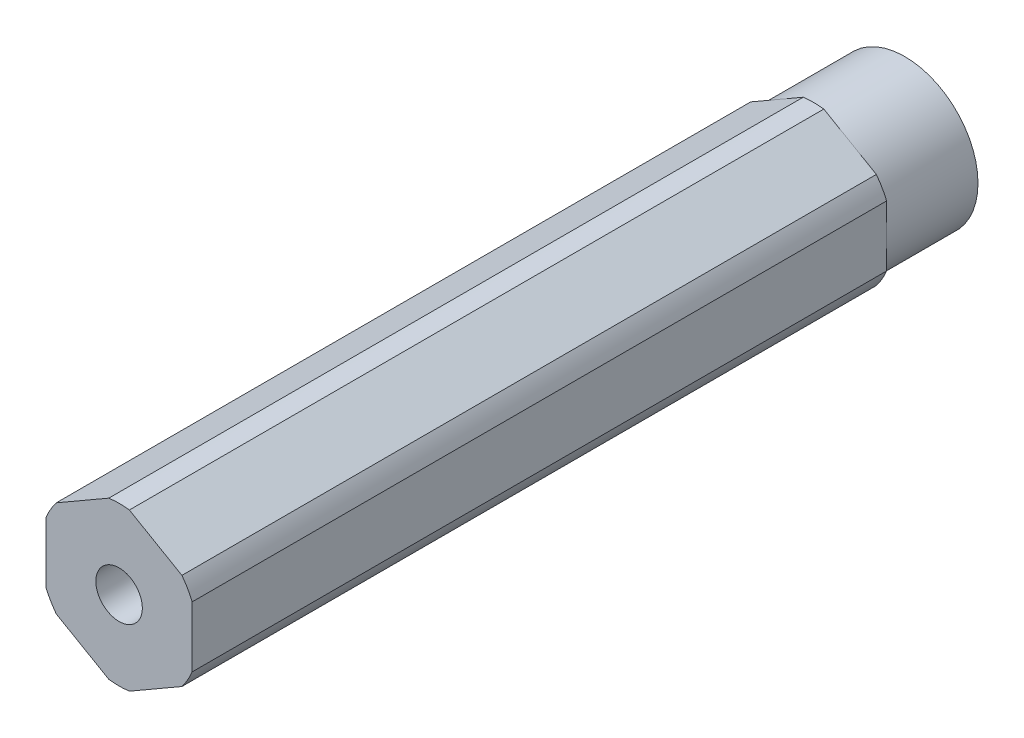
from build123d import *

# Parameters (mm, degrees)
BOSS_EXTRUDE1_DEPTH                  = 34.13125
SKETCH3_R                            = 2.0193
CUT_EXTRUDE1_DEPTH                   = 69.901066982
CUT_EXTRUDE3_START                   = -7.9375
SKETCH8_R                            = 6.875
SKETCH8_R_2                          = 6.35
CUT_EXTRUDE3_DEPTH                   = 7.9375
F_10_32_TAPPED_HOLE1_D               = 4.0386
F_10_32_TAPPED_HOLE1_DEPTH           = 12.02944
F_10_32_TAPPED_HOLE1_TIP             = 1.213317848
F_10_32_TAPPED_HOLE1_ON_FACE_2_D     = 4.0386
F_10_32_TAPPED_HOLE1_ON_FACE_2_DEPTH = 12.02944
F_10_32_TAPPED_HOLE1_ON_FACE_2_TIP   = 1.213317848


with BuildPart() as part:
    # Sketch1 → Boss-Extrude1 (new, symmetric)
    with BuildSketch(Plane.XY):
        with BuildLine():
            Line((-0.893039494, 6.816751826), (-5.456960506, 4.181770802))
            ThreePointArc((-5.456960506, 4.181770802), (-5.953924651, 3.4375), (-6.35, 2.634981025))
            Line((-6.35, 2.634981025), (-6.35, -2.634981025))
            ThreePointArc((-6.35, -2.634981025), (-5.953924651, -3.4375), (-5.456960506, -4.181770802))
            Line((-5.456960506, -4.181770802), (-0.893039494, -6.816751826))
            ThreePointArc((-0.893039494, -6.816751826), (0, -6.875), (0.893039494, -6.816751826))
            Line((0.893039494, -6.816751826), (5.456960506, -4.181770802))
            ThreePointArc((5.456960506, -4.181770802), (5.953924651, -3.4375), (6.35, -2.634981025))
            Line((6.35, -2.634981025), (6.35, 2.634981025))
            ThreePointArc((6.35, 2.634981025), (5.953924651, 3.4375), (5.456960506, 4.181770802))
            Line((5.456960506, 4.181770802), (0.893039494, 6.816751826))
            ThreePointArc((0.893039494, 6.816751826), (0, 6.875), (-0.893039494, 6.816751826))
        make_face()
    extrude(amount=BOSS_EXTRUDE1_DEPTH, both=True)

    # Sketch3 → Cut-Extrude1 (cut, through all)
    with BuildSketch(Plane.XY.offset(34.13125)):
        Circle(SKETCH3_R)
    extrude(amount=-CUT_EXTRUDE1_DEPTH, mode=Mode.SUBTRACT)

    # Sketch8 → Cut-Extrude3 (cut)
    with BuildSketch(Plane(origin=(0, 0, -34.13125), x_dir=(-1, 0, 0), z_dir=(0, 0, -1)).offset(CUT_EXTRUDE3_START)):
        Circle(SKETCH8_R)
        Circle(SKETCH8_R_2, mode=Mode.SUBTRACT)
    extrude(amount=CUT_EXTRUDE3_DEPTH, mode=Mode.SUBTRACT)

    # #10-32 Tapped Hole1
    with Locations(Plane(origin=(0, 0, -34.13125), x_dir=(-1, 0, 0), z_dir=(0, 0, -1))):
        with Locations((0, 0)):
            Hole(F_10_32_TAPPED_HOLE1_D / 2, depth=F_10_32_TAPPED_HOLE1_DEPTH)
            with Locations((0, 0, -(F_10_32_TAPPED_HOLE1_DEPTH + F_10_32_TAPPED_HOLE1_TIP / 2))):  # 118° drill point
                Cone(0, F_10_32_TAPPED_HOLE1_D / 2, F_10_32_TAPPED_HOLE1_TIP, mode=Mode.SUBTRACT)

    # #10-32 Tapped Hole1 on face 2
    with Locations(Plane(origin=(0, 0, 34.13125), x_dir=(-1, 0, 0), z_dir=(0, 0, -1))):
        with Locations((0, 0)):
            Hole(F_10_32_TAPPED_HOLE1_ON_FACE_2_D / 2, depth=F_10_32_TAPPED_HOLE1_ON_FACE_2_DEPTH)
            with Locations((0, 0, -(F_10_32_TAPPED_HOLE1_ON_FACE_2_DEPTH + F_10_32_TAPPED_HOLE1_ON_FACE_2_TIP / 2))):  # 118° drill point
                Cone(0, F_10_32_TAPPED_HOLE1_ON_FACE_2_D / 2, F_10_32_TAPPED_HOLE1_ON_FACE_2_TIP, mode=Mode.SUBTRACT)


solid = part.part
